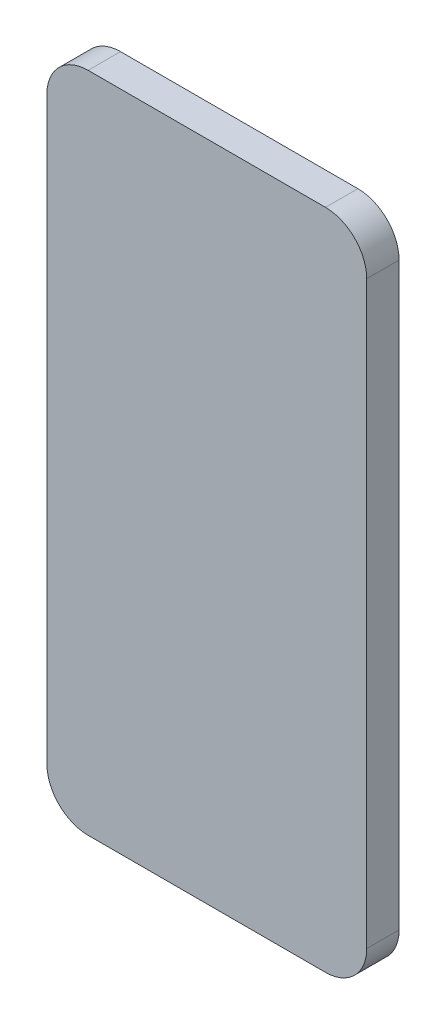
from build123d import *

# Parameters (mm, degrees)
IZIM1_W                     = 77.58
IZIM1_H                     = 160.7
Y_KSEKLIK_EKSTR_ZYON1_DEPTH = 7.85
RADYUS1_R                   = 10
Y_KSEKLIK_EKSTR_ZYON2_DEPTH = 2


with BuildPart() as part:
    # Çizim1 → Yükseklik-Ekstrüzyon1 (new body)
    with BuildSketch(Plane.XY):
        with Locations((15.94448574, -50.114448669)):
            Rectangle(IZIM1_W, IZIM1_H)
    extrude(amount=Y_KSEKLIK_EKSTR_ZYON1_DEPTH)

    # Radyus1
    radyus1_edges = [part.edges().sort_by_distance(p)[0] for p in [
        (54.73448574, -130.464448669, 3.925),
        (-22.84551426, -130.464448669, 3.925),
        (-22.84551426, 30.235551331, 3.925),
        (54.73448574, 30.235551331, 3.925),
    ]]
    fillet(radyus1_edges, radius=RADYUS1_R)

    # Çizim3 → Yükseklik-Ekstrüzyon2 (add)
    with BuildSketch(Plane(origin=(0, 0, 0), x_dir=(-1, 0, 0), z_dir=(0, 0, -1))):
        with BuildLine():
            Line((-42.73448574, 28.235551331), (-22.73448574, 28.235551331))
            ThreePointArc((-22.73448574, 28.235551331), (-15.663417928, 25.306619143), (-12.73448574, 18.235551331))
            Line((-12.73448574, 18.235551331), (-12.73448574, -1.764448669))
            ThreePointArc((-12.73448574, -1.764448669), (-15.663417928, -8.835516481), (-22.73448574, -11.764448669))
            Line((-22.73448574, -11.764448669), (-42.73448574, -11.764448669))
            ThreePointArc((-42.73448574, -11.764448669), (-49.805553552, -8.835516481), (-52.73448574, -1.764448669))
            Line((-52.73448574, -1.764448669), (-52.73448574, 18.235551331))
            ThreePointArc((-52.73448574, 18.235551331), (-49.805553552, 25.306619143), (-42.73448574, 28.235551331))
        make_face()
    extrude(amount=Y_KSEKLIK_EKSTR_ZYON2_DEPTH)


solid = part.part
